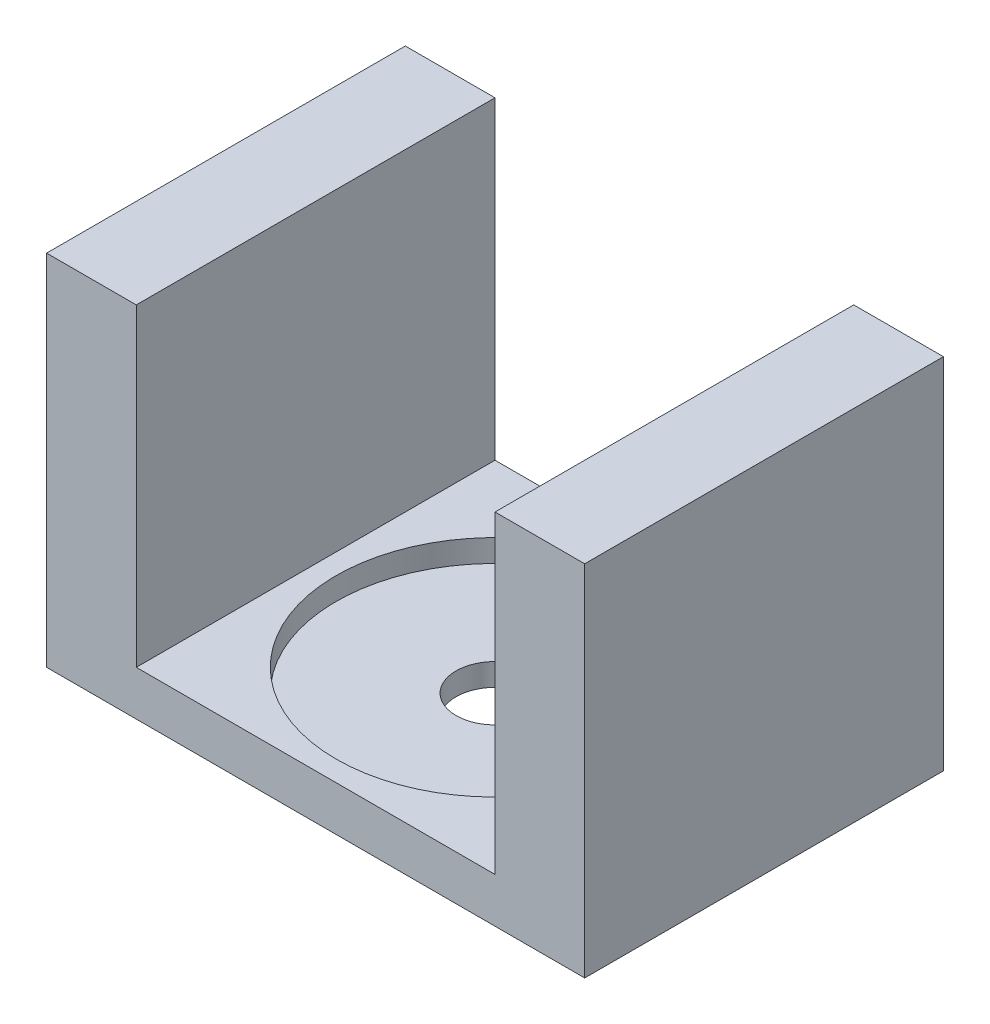
from build123d import *

# Parameters (mm, degrees)
BOSS_EXTRUDE1_DEPTH = 50.8
SKETCH2_R           = 22.5044
CUT_EXTRUDE1_DEPTH  = 3.175
SKETCH3_R           = 5.5
CUT_EXTRUDE2_DEPTH  = 80.375


with BuildPart() as part:
    # Sketch1 → Boss-Extrude1 (new body)
    with BuildSketch(Plane.XY):
        Polygon((38.1, 0), (-38.1, 0), (-38.1, 50.8), (-25.4, 50.8), (-25.4, 6.35), (25.4, 6.35), (25.4, 50.8), (38.1, 50.8), align=None)
    extrude(amount=BOSS_EXTRUDE1_DEPTH)

    # Sketch2 → Cut-Extrude1 (cut)
    with BuildSketch(Plane(origin=(0, 6.35, 0), x_dir=(1, 0, 0), z_dir=(0, 1, 0))):
        with Locations((0, -25.4)):
            Circle(SKETCH2_R)
    extrude(amount=-CUT_EXTRUDE1_DEPTH, mode=Mode.SUBTRACT)

    # Sketch3 → Cut-Extrude2 (cut, through all)
    with BuildSketch(Plane(origin=(0, 3.175, 0), x_dir=(1, 0, 0), z_dir=(0, 1, 0))):
        with Locations((0, -25.4)):
            Circle(SKETCH3_R)
    extrude(amount=-CUT_EXTRUDE2_DEPTH, mode=Mode.SUBTRACT)


solid = part.part
